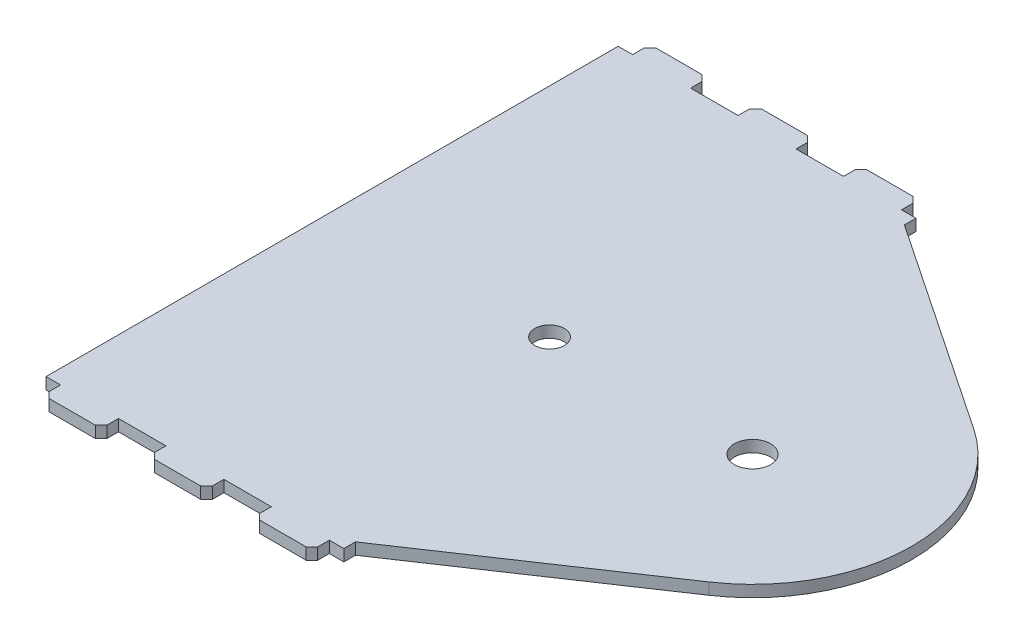
from build123d import *

# Parameters (mm, degrees)
SM_BASE_FLANGE_1_DEPTH = 4
OTHER_1_DEPTH          = 4


# Read off the part's stored shape, not the designer's step: Выступы и прорези-Выступ1
# Sheet-metal steps are written as plain solids
with BuildPart() as part:
    # Sketch 1 → Базовая кромка1 (new body)
    with BuildSketch(Plane(origin=(0, 0, 0), x_dir=(1, 0, 0), z_dir=(0, 1, 0))):
        with BuildLine():
            Line((-145, -98.667725183), (-145, 0))
            Line((-145, 0), (-75.1, 0))
            ThreePointArc((-75.1, 0), (-70, -5.1), (-64.9, 0))
            Line((-64.9, 0), (-6.25, 0))
            ThreePointArc((-6.25, 0), (0, -6.25), (6.25, 0))
            Line((6.25, 0), (55, 0))
            ThreePointArc((55, 0), (48.538654235, -25.865015853), (30.672761998, -45.652838591))
            Line((30.672761998, -45.652838591), (-42.280195622, -94.667725183))
            Line((-42.280195622, -94.667725183), (-42.280195622, -98.667725183))
            Line((-42.280195622, -98.667725183), (-145, -98.667725183))
        make_face()
    extrude(amount=SM_BASE_FLANGE_1_DEPTH)

    # Other 1 outline → Other 1 (add)
    with BuildSketch(Plane(origin=(0, 0, 0), x_dir=(1, 0, 0), z_dir=(0, 1, 0))):
        Polygon((-47.280195622, -98.667725183), (-67.280195622, -98.667725183), (-67.280195622, -102.667725183), (-65.280195622, -104.667725183), (-49.280195622, -104.667725183), (-47.280195622, -102.667725183), align=None)
        Polygon((-83.640097811, -98.667725183), (-103.640097811, -98.667725183), (-103.640097811, -102.667725183), (-101.640097811, -104.667725183), (-85.640097811, -104.667725183), (-83.640097811, -102.667725183), align=None)
        Polygon((-140, -98.667725183), (-140, -102.667725183), (-138, -104.667725183), (-122, -104.667725183), (-120, -102.667725183), (-120, -98.667725183), align=None)
    extrude(amount=OTHER_1_DEPTH)

    # Зеркальное отражение1: part across plane


with BuildPart() as part_1:
    add(part.part)
    add(part.part.mirror(Plane(origin=(-145, 4, 0), x_dir=(1, 0, 0), z_dir=(0, 0, 1))))


solid = part_1.part
